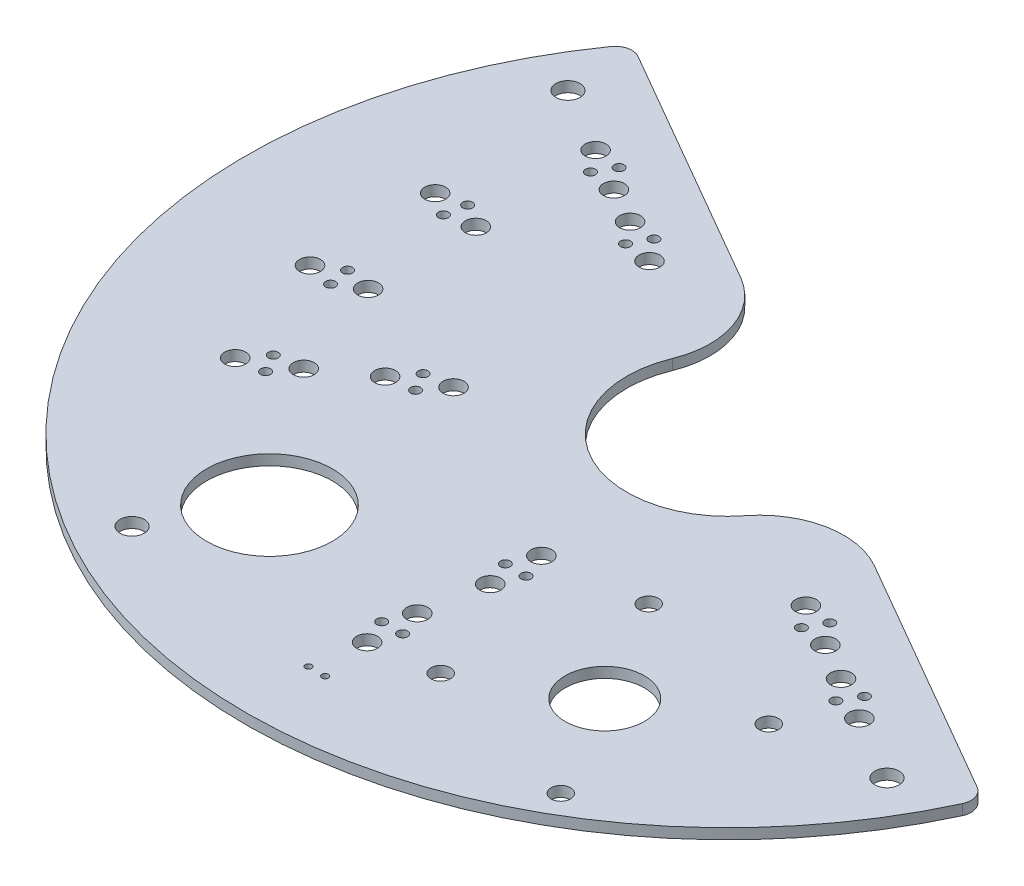
from build123d import *

# Parameters (mm, degrees)
SKETCH1_R           = 73.025
SKETCH1_R_2         = 15.24
SKETCH1_R_3         = 0.75
SKETCH1_R_4         = 1.585
SKETCH1_R_5         = 20
SKETCH1_R_6         = 9.525
SKETCH1_R_7         = 6
BOSS_EXTRUDE1_DEPTH = 1.5875
SKETCH2_R           = 1.8288
CUT_EXTRUDE1_DEPTH  = 104.285146107
CUT_EXTRUDE2_DEPTH  = 104.285146107
FILLET1_R           = 12.7
FILLET2_R           = 2.54
SKETCH4_R           = 0.4953
CUT_EXTRUDE3_DEPTH  = 104.285146107
SKETCH5_R           = 0.4953
SKETCH5_R_2         = 0.75
BOSS_EXTRUDE2_DEPTH = 0.1016
SKETCH6_R           = 1.4732
CUT_EXTRUDE4_DEPTH  = 104.285146107


with BuildPart() as part:
    # Sketch1 → Boss-Extrude1 (new body)
    with BuildSketch(Plane(origin=(0, 0, 0), x_dir=(1, 0, 0), z_dir=(0, 1, 0))):
        Circle(SKETCH1_R)
        Circle(SKETCH1_R_2, mode=Mode.SUBTRACT)
        with Locations((-1.585, 50.8)):
            Circle(SKETCH1_R_3, mode=Mode.SUBTRACT)
        with Locations((1.585, 50.8)):
            Circle(SKETCH1_R_3, mode=Mode.SUBTRACT)
        with Locations((0, 54.6)):
            Circle(SKETCH1_R_4, mode=Mode.SUBTRACT)
        with Locations((0, 47)):
            Circle(SKETCH1_R_4, mode=Mode.SUBTRACT)
        with Locations((47.284987047, 27.3)):
            Circle(SKETCH1_R_4, mode=Mode.SUBTRACT)
        with Locations((43.201590512, 26.772650265)):
            Circle(SKETCH1_R_3, mode=Mode.SUBTRACT)
        with Locations((44.786590512, 24.027349735)):
            Circle(SKETCH1_R_3, mode=Mode.SUBTRACT)
        with Locations((40.703193978, 23.5)):
            Circle(SKETCH1_R_4, mode=Mode.SUBTRACT)
        with Locations((47.284987047, -27.3)):
            Circle(SKETCH1_R_4, mode=Mode.SUBTRACT)
        with Locations((44.786590512, -24.027349735)):
            Circle(SKETCH1_R_3, mode=Mode.SUBTRACT)
        with Locations((43.201590512, -26.772650265)):
            Circle(SKETCH1_R_3, mode=Mode.SUBTRACT)
        with Locations((40.703193978, -23.5)):
            Circle(SKETCH1_R_4, mode=Mode.SUBTRACT)
        with Locations((0, -54.6)):
            Circle(SKETCH1_R_4, mode=Mode.SUBTRACT)
        with Locations((1.585, -50.8)):
            Circle(SKETCH1_R_3, mode=Mode.SUBTRACT)
        with Locations((-1.585, -50.8)):
            Circle(SKETCH1_R_3, mode=Mode.SUBTRACT)
        with Locations((0, -47)):
            Circle(SKETCH1_R_4, mode=Mode.SUBTRACT)
        with Locations((-47.284987047, -27.3)):
            Circle(SKETCH1_R_4, mode=Mode.SUBTRACT)
        with Locations((-43.201590512, -26.772650265)):
            Circle(SKETCH1_R_3, mode=Mode.SUBTRACT)
        with Locations((-44.786590512, -24.027349735)):
            Circle(SKETCH1_R_3, mode=Mode.SUBTRACT)
        with Locations((-40.703193978, -23.5)):
            Circle(SKETCH1_R_4, mode=Mode.SUBTRACT)
        with Locations((-47.284987047, 27.3)):
            Circle(SKETCH1_R_4, mode=Mode.SUBTRACT)
        with Locations((-44.786590512, 24.027349735)):
            Circle(SKETCH1_R_3, mode=Mode.SUBTRACT)
        with Locations((-43.201590512, 26.772650265)):
            Circle(SKETCH1_R_3, mode=Mode.SUBTRACT)
        with Locations((-40.703193978, 23.5)):
            Circle(SKETCH1_R_4, mode=Mode.SUBTRACT)
        with Locations((25.4, 43.994090512)):
            Circle(SKETCH1_R_5, mode=Mode.SUBTRACT)
        with Locations((-25.4, -43.994090512)):
            Circle(SKETCH1_R_6, mode=Mode.SUBTRACT)
        with Locations((25.4, -43.994090512)):
            Circle(SKETCH1_R_7, mode=Mode.SUBTRACT)
        with Locations((-46.285964392, 8.16146435)):
            Circle(SKETCH1_R_4, mode=Mode.SUBTRACT)
        with Locations((-50.303466215, 7.260407137)):
            Circle(SKETCH1_R_3, mode=Mode.SUBTRACT)
        with Locations((-49.753001491, 10.382247714)):
            Circle(SKETCH1_R_3, mode=Mode.SUBTRACT)
        with Locations((-53.770503314, 9.481190501)):
            Circle(SKETCH1_R_4, mode=Mode.SUBTRACT)
        with Locations((-46.285964392, -8.16146435)):
            Circle(SKETCH1_R_4, mode=Mode.SUBTRACT)
        with Locations((-49.753001491, -10.382247714)):
            Circle(SKETCH1_R_3, mode=Mode.SUBTRACT)
        with Locations((-50.303466215, -7.260407137)):
            Circle(SKETCH1_R_3, mode=Mode.SUBTRACT)
        with Locations((-53.770503314, -9.481190501)):
            Circle(SKETCH1_R_4, mode=Mode.SUBTRACT)
        with Locations((-29.397305699, -17.855276467)):
            Circle(SKETCH1_R_3, mode=Mode.SUBTRACT)
        with Locations((-31.002036221, -15.116847022)):
            Circle(SKETCH1_R_3, mode=Mode.SUBTRACT)
        with Locations((-33.503208801, -18.377965576)):
            Circle(SKETCH1_R_4, mode=Mode.SUBTRACT)
        with Locations((-26.914267425, -14.590346807)):
            Circle(SKETCH1_R_4, mode=Mode.SUBTRACT)
        with Locations((0.18310412, -33.841026905)):
            Circle(SKETCH1_R_3, mode=Mode.SUBTRACT)
        with Locations((3.356893615, -33.875899805)):
            Circle(SKETCH1_R_3, mode=Mode.SUBTRACT)
        with Locations((1.849768537, -30.052376234)):
            Circle(SKETCH1_R_4, mode=Mode.SUBTRACT)
        with Locations((1.702835812, -37.650969207)):
            Circle(SKETCH1_R_4, mode=Mode.SUBTRACT)
        with Locations((30.985856532, -19.788486735)):
            Circle(SKETCH1_R_3, mode=Mode.SUBTRACT)
        with Locations((32.50665139, -17.002568775)):
            Circle(SKETCH1_R_3, mode=Mode.SUBTRACT)
        with Locations((28.42312809, -16.538245649)):
            Circle(SKETCH1_R_4, mode=Mode.SUBTRACT)
        with Locations((35.063306729, -20.235302863)):
            Circle(SKETCH1_R_4, mode=Mode.SUBTRACT)
        with Locations((-32.704469206, 17.259289581)):
            Circle(SKETCH1_R_3, mode=Mode.SUBTRACT)
        with Locations((-31.183674349, 20.045207541)):
            Circle(SKETCH1_R_3, mode=Mode.SUBTRACT)
        with Locations((-35.267197648, 20.509530667)):
            Circle(SKETCH1_R_4, mode=Mode.SUBTRACT)
        with Locations((-28.627019009, 16.812473453)):
            Circle(SKETCH1_R_4, mode=Mode.SUBTRACT)
    extrude(amount=-BOSS_EXTRUDE1_DEPTH)

    # Sketch2 → Cut-Extrude1 (cut, through all)
    with BuildSketch(Plane(origin=(0, 0, 0), x_dir=(1, 0, 0), z_dir=(0, 1, 0))):
        with Locations((-57.192317666, 33.02)):
            Circle(SKETCH2_R)
        with Locations((33.02, 57.192317666)):
            Circle(SKETCH2_R)
        with Locations((57.192317666, -33.02)):
            Circle(SKETCH2_R)
        with Locations((-33.02, -57.192317666)):
            Circle(SKETCH2_R)
    extrude(amount=-CUT_EXTRUDE1_DEPTH, mode=Mode.SUBTRACT)

    # Sketch3 → Cut-Extrude2 (cut, through all)
    with BuildSketch(Plane(origin=(0, 0, 0), x_dir=(1, 0, 0), z_dir=(0, 1, 0))):
        with BuildLine():
            Line((-59.533825484, 44.637157955), (68.423825484, -29.239226276))
            ThreePointArc((68.423825484, -29.239226276), (37.204677955, 64.440392498), (-59.533825484, 44.637157955))
        make_face()
    extrude(amount=-CUT_EXTRUDE2_DEPTH, mode=Mode.SUBTRACT)

    # Fillet1
    fillet1_edges = [part.edges().sort_by_distance(p)[0] for p in [
        (15.165033815, -0.79375, -1.509751431),
        (-6.275033815, -0.79375, -13.888180249),
    ]]
    fillet(fillet1_edges, radius=FILLET1_R)

    # Fillet2
    fillet2_edges = [part.edges().sort_by_distance(p)[0] for p in [
        (67.216123088, -0.79375, 28.541958973),
        (-58.326123088, -0.79375, -43.939890652),
    ]]
    fillet(fillet2_edges, radius=FILLET2_R)

    # Sketch4 → Cut-Extrude3 (cut, through all)
    with BuildSketch(Plane(origin=(0, 0, 0), x_dir=(1, 0, 0), z_dir=(0, 1, 0))):
        with Locations((1.27, -62.23)):
            Circle(SKETCH4_R)
        with Locations((-1.27, -62.23)):
            Circle(SKETCH4_R)
    extrude(amount=-CUT_EXTRUDE3_DEPTH, mode=Mode.SUBTRACT)

    # Sketch5 → Boss-Extrude2 (add)
    # profile 1 of 7: a face of its own
    with BuildSketch(Plane.XZ.offset(1.5875)):
        with BuildLine():
            Line((34.421138413, 15.230954412), (44.954212308, 21.298619322))
            ThreePointArc((44.954212308, 21.298619322), (44.556975212, 22.118734561), (44.144801135, 22.931445362))
            ThreePointArc((44.144801135, 22.931445362), (44.244233856, 25.175717819), (46.040660751, 23.82683082))
            ThreePointArc((46.040660751, 23.82683082), (46.421042892, 23.076981739), (46.789213497, 22.32106202))
            Line((46.789213497, 22.32106202), (54.774266163, 26.931234326))
            ThreePointArc((54.774266163, 26.931234326), (32.789239067, 51.481816376), (1.245393112, 61.024262486))
            ThreePointArc((1.245393112, 61.024262486), (0.064262486, 62.254606888), (1.294606888, 63.435737514))
            ThreePointArc((1.294606888, 63.435737514), (34.873073505, 53.006014236), (57.7422016, 26.298421156))
            Line((57.7422016, 26.298421156), (28.012465947, 9.133950273))
            ThreePointArc((28.012465947, 9.133950273), (-11.801974978, 20.593749612), (-22.30608396, -19.483430947))
            Line((-22.30608396, -19.483430947), (-29.83516689, -23.556613806))
            Line((-29.83516689, -23.556613806), (-36.397117592, -27.130853687))
            Line((-36.397117592, -27.130853687), (-39.459709044, -21.521462671))
            ThreePointArc((-39.459709044, -21.521462671), (-43.38379222, -11.090113617), (-44.273580184, 0.01933053))
            Line((-44.273580184, 0.01933053), (-49.878278294, -0.05282308))
            ThreePointArc((-49.878278294, -0.05282308), (-49.776909744, -3.179694604), (-49.479437443, -6.294034237))
            ThreePointArc((-49.479437443, -6.294034237), (-50.077899927, -8.510215062), (-51.413325303, -6.643063793))
            ThreePointArc((-51.413325303, -6.643063793), (-51.840720627, -2e-09), (-51.4133253, 6.643063788))
            ThreePointArc((-51.4133253, 6.643063788), (-50.078487611, 8.510320985), (-49.478529034, 6.294809577))
            ThreePointArc((-49.478529034, 6.294809577), (-49.678739529, 4.451054022), (-49.810172147, 2.601123145))
            Line((-49.810172147, 2.601123145), (-41.994222134, 2.662628968))
            ThreePointArc((-41.994222134, 2.662628968), (-41.18813924, -10.59414945), (-36.50410532, -23.022012095))
            Line((-36.50410532, -23.022012095), (-35.928794568, -24.049843158))
            Line((-35.928794568, -24.049843158), (-31.053590427, -21.385433264))
            ThreePointArc((-31.053590427, -21.385433264), (-31.761936541, -19.017766992), (-30.06523382, -20.814652539))
            Line((-30.06523382, -20.814652539), (-29.551271602, -21.703985881))
            Line((-29.551271602, -21.703985881), (-25.045535575, -19.082790815))
            ThreePointArc((-25.045535575, -19.082790815), (-12.870192285, 22.241050439), (29.001504046, 12.108928914))
            Line((29.001504046, 12.108928914), (33.431303182, 14.660751586))
            ThreePointArc((33.431303182, 14.660751586), (33.105281577, 15.233598122), (32.771708156, 15.802080323))
            ThreePointArc((32.771708156, 15.802080323), (31.537563024, 17.918319695), (33.677676765, 16.726054429))
            ThreePointArc((33.677676765, 16.726054429), (34.055427477, 15.981497903), (34.421138413, 15.230954412))
        make_face()
        with Locations((1.27, 62.23)):
            Circle(SKETCH5_R, mode=Mode.SUBTRACT)
        with Locations((44.786590512, 24.027349735)):
            Circle(SKETCH5_R_2, mode=Mode.SUBTRACT)
        with Locations((-50.303466215, 7.260407137)):
            Circle(SKETCH5_R_2, mode=Mode.SUBTRACT)
        with Locations((-50.303466215, -7.260407137)):
            Circle(SKETCH5_R_2, mode=Mode.SUBTRACT)
        with Locations((-31.173750375, -20.038911028)):
            Circle(SKETCH5_R_2, mode=Mode.SUBTRACT)
        with Locations((32.507430232, 16.993318336)):
            Circle(SKETCH5_R_2, mode=Mode.SUBTRACT)
    # profile 2 of 7: a face of its own
    with BuildSketch(Plane.XZ.offset(1.5875)):
        with BuildLine():
            Line((-43.267876977, 43.051160703), (-27.585042327, 27.733137144))
            ThreePointArc((-27.585042327, 27.733137144), (-29.041623168, 26.203922984), (-30.413547782, 24.598324482))
            Line((-30.413547782, 24.598324482), (-41.535902064, 31.019818721))
            ThreePointArc((-41.535902064, 31.019818721), (-42.622921384, 29.508420604), (-43.654971227, 27.958966381))
            ThreePointArc((-43.654971227, 27.958966381), (-43.840354357, 25.674979663), (-41.946175936, 26.964572755))
            ThreePointArc((-41.946175936, 26.964572755), (-41.493466309, 27.654922247), (-41.02937716, 28.337673804))
            Line((-41.02937716, 28.337673804), (-29.89025274, 21.949848454))
            ThreePointArc((-29.89025274, 21.949848454), (-27.893847383, 24.436782402), (-25.69115282, 26.742993901))
            Line((-25.69115282, 26.742993901), (-24.169936933, 25.075510162))
            ThreePointArc((-24.169936933, 25.075510162), (-27.087264805, 22.221004628), (-29.697033, 19.082834184))
            ThreePointArc((-29.697033, 19.082834184), (-30.254991066, 16.880593019), (-28.158390528, 17.75549275))
            ThreePointArc((-28.158390528, 17.75549275), (-16.302373049, 28.548130039), (-0.892844209, 32.974481926))
            ThreePointArc((-0.892844209, 32.974481926), (1.313564772, 33.515723797), (-0.44322017, 34.956171651))
            ThreePointArc((-0.44322017, 34.956171651), (-12.346020741, 32.298069607), (-22.885834404, 26.161743684))
            Line((-22.885834404, 26.161743684), (-24.433206187, 27.896979969))
            ThreePointArc((-24.433206187, 27.896979969), (-14.936850447, 33.942798275), (-4.064, 36.860642425))
            Line((-4.064, 36.860642425), (-4.133582426, 49.639470825))
            ThreePointArc((-4.133582426, 49.639470825), (-3.220870082, 49.705755448), (-2.307094013, 49.755260685))
            ThreePointArc((-2.307094013, 49.755260685), (-0.315950299, 50.849120844), (-2.385689571, 51.785797247))
            ThreePointArc((-2.385689571, 51.785797247), (-4.243581193, 51.666742978), (-6.095999999, 51.481055694))
            Line((-6.095999999, 51.481055694), (-6.095999999, 38.638067239))
            ThreePointArc((-6.095999999, 38.638067239), (-16.444294193, 35.491501018), (-25.535262245, 29.631264538))
            Line((-25.535262245, 29.631264538), (-41.159837062, 45.070826807))
            ThreePointArc((-41.159837062, 45.070826807), (-22.603261013, 56.697479729), (-1.137328397, 61.026372169))
            ThreePointArc((-1.137328397, 61.026372169), (-0.059313178, 62.253645904), (-1.184427718, 63.437890349))
            ThreePointArc((-1.184427718, 63.437890349), (-54.638937713, 32.254539007), (-56.114446622, -29.613133594))
            ThreePointArc((-56.114446622, -29.613133594), (-48.096517974, -33.298196385), (-41.94696977, -26.969695421))
            ThreePointArc((-41.94696977, -26.969695421), (-43.838112814, -25.673678309), (-43.654971249, -27.958966373))
            ThreePointArc((-43.654971249, -27.958966373), (-48.48912176, -31.684499357), (-53.841207423, -28.751278219))
            ThreePointArc((-53.841207423, -28.751278219), (-60.385769243, 8.892158846), (-43.267876977, 43.051160703))
        make_face()
        with Locations((-1.27, 62.23)):
            Circle(SKETCH5_R, mode=Mode.SUBTRACT)
        with Locations((-1.585, 50.8)):
            Circle(SKETCH5_R_2, mode=Mode.SUBTRACT)
        with Locations((-43.201590512, 26.772650265)):
            Circle(SKETCH5_R_2, mode=Mode.SUBTRACT)
        with Locations((-43.201590512, -26.772650265)):
            Circle(SKETCH5_R_2, mode=Mode.SUBTRACT)
        with Locations((-29.39844648, 17.849058536)):
            Circle(SKETCH5_R_2, mode=Mode.SUBTRACT)
        with Locations((0.184301483, 33.838710291)):
            Circle(SKETCH5_R_2, mode=Mode.SUBTRACT)
    # profile 3 of 7: a face of its own
    with BuildSketch(Plane.XZ.offset(1.5875)):
        with BuildLine():
            Line((33.336492348, 26.169869046), (41.53590203, 31.019818697))
            ThreePointArc((41.53590203, 31.019818697), (42.622921331, 29.508420605), (43.654971158, 27.958966407))
            ThreePointArc((43.654971158, 27.958966407), (43.922735315, 25.72725552), (41.931593017, 26.770128224))
            ThreePointArc((41.931593017, 26.770128224), (41.418306686, 27.558819791), (40.890212308, 28.337673804))
            Line((40.890212308, 28.337673804), (32.476569676, 23.819841654))
            ThreePointArc((32.476569676, 23.819841654), (19.965352292, 34.978524014), (3.994943482, 40.076836963))
            Line((3.994943482, 40.076836963), (3.994943482, 49.645894905))
            ThreePointArc((3.994943482, 49.645894905), (3.151482947, 49.707741817), (2.307094012, 49.755260685))
            ThreePointArc((2.307094012, 49.755260685), (0.3159503, 50.849120846), (2.385689574, 51.785797244))
            ThreePointArc((2.385689574, 51.785797244), (4.243581194, 51.666742973), (6.095999998, 51.481055688))
            Line((6.095999998, 51.481055688), (6.095999998, 41.940702808))
            ThreePointArc((6.095999998, 41.940702808), (21.234645336, 36.677971665), (33.336492348, 26.169869046))
        make_face()
        with Locations((1.585, 50.8)):
            Circle(SKETCH5_R_2, mode=Mode.SUBTRACT)
        with Locations((43.201590512, 26.772650265)):
            Circle(SKETCH5_R_2, mode=Mode.SUBTRACT)
    # profile 4 of 7: a face of its own
    with BuildSketch(Plane.XZ.offset(1.5875)):
        with BuildLine():
            ThreePointArc((-48.647518561, -11.00739369), (-49.969128239, -9.130772893), (-50.584784029, -11.341954862))
            ThreePointArc((-50.584784029, -11.341954862), (-48.714342632, -17.7305707), (-46.040660767, -23.826830917))
            ThreePointArc((-46.040660767, -23.826830917), (-44.151119366, -25.126929847), (-44.334226437, -22.840645583))
            ThreePointArc((-44.334226437, -22.840645583), (-46.866405338, -17.060903635), (-48.647518561, -11.00739369))
        make_face()
        with Locations((-49.753001492, -10.382247714)):
            Circle(SKETCH5_R_2, mode=Mode.SUBTRACT)
        with Locations((-44.786590512, -24.027349735)):
            Circle(SKETCH5_R_2, mode=Mode.SUBTRACT)
    # profile 5 of 7: a face of its own
    with BuildSketch(Plane.XZ.offset(1.5875)):
        with BuildLine():
            ThreePointArc((-50.584784022, 11.341954868), (-49.970158144, 9.130951191), (-48.646491059, 11.0055732))
            ThreePointArc((-48.646491059, 11.0055732), (-46.864082265, 17.060920093), (-44.330138447, 22.842211974))
            ThreePointArc((-44.330138447, 22.842211974), (-44.153015498, 25.128023484), (-46.040660764, 23.826830898))
            ThreePointArc((-46.040660764, 23.826830898), (-46.866502564, 22.158322403), (-47.63190207, 20.461236999))
            ThreePointArc((-47.63190207, 20.461236999), (-49.319566942, 15.969991584), (-50.584784022, 11.341954868))
        make_face()
        with Locations((-44.786590512, 24.027349735)):
            Circle(SKETCH5_R_2, mode=Mode.SUBTRACT)
        with Locations((-49.753001492, 10.382247714)):
            Circle(SKETCH5_R_2, mode=Mode.SUBTRACT)
    # profile 6 of 7: a face of its own
    with BuildSketch(Plane.XZ.offset(1.5875)):
        with BuildLine():
            ThreePointArc((29.750286049, 20.294824353), (31.818786572, 18.884056056), (30.842384069, 21.189614503))
            ThreePointArc((30.842384069, 21.189614503), (19.436792184, 31.341447854), (4.523593019, 34.619211922))
            ThreePointArc((4.523593019, 34.619211922), (2.183689823, 33.970896872), (4.484099362, 33.193995769))
            ThreePointArc((4.484099362, 33.193995769), (18.709722164, 29.863769073), (29.750286049, 20.294824353))
        make_face()
        with Locations((3.354949812, 33.875033472)):
            Circle(SKETCH5_R_2, mode=Mode.SUBTRACT)
        with Locations((30.984541636, 19.78920211)):
            Circle(SKETCH5_R_2, mode=Mode.SUBTRACT)
    # profile 7 of 7: a face of its own
    with BuildSketch(Plane.XZ.offset(1.5875)):
        with BuildLine():
            ThreePointArc((-31.336769265, 13.038282839), (-30.328093766, 16.217420137), (-32.984953468, 14.201127316))
            ThreePointArc((-32.984953468, 14.201127316), (-33.66330563, 12.920695881), (-34.330413979, 11.634370586))
            ThreePointArc((-34.330413979, 11.634370586), (-37.669342414, -2.643171748), (-33.915331162, -16.817234599))
            ThreePointArc((-33.915331162, -16.817234599), (-32.492330711, -18.588181541), (-31.929291004, -16.3872341))
            ThreePointArc((-31.929291004, -16.3872341), (-32.27952678, -15.643177599), (-32.64152132, -14.904770442))
            ThreePointArc((-32.64152132, -14.904770442), (-35.634138362, -0.763047218), (-31.336769265, 13.038282839))
        make_face()
        with Locations((-32.718295999, -17.260138496)):
            Circle(SKETCH5_R_2, mode=Mode.SUBTRACT)
        with Locations((-31.007036728, 15.122901043)):
            Circle(SKETCH5_R_2, mode=Mode.SUBTRACT)
    extrude(amount=BOSS_EXTRUDE2_DEPTH)

    # Sketch6 → Cut-Extrude4 (cut, through all)
    with BuildSketch(Plane.XZ.offset(1.5875)):
        with Locations((34.496852839, 59.750301818)):
            Circle(SKETCH6_R)
        with Locations((9.643788694, 53.090943351)):
            Circle(SKETCH6_R)
        with Locations((16.303147161, 28.237879206)):
            Circle(SKETCH6_R)
        with Locations((41.156211306, 34.897237673)):
            Circle(SKETCH6_R)
    extrude(amount=-CUT_EXTRUDE4_DEPTH, mode=Mode.SUBTRACT)


solid = part.part
